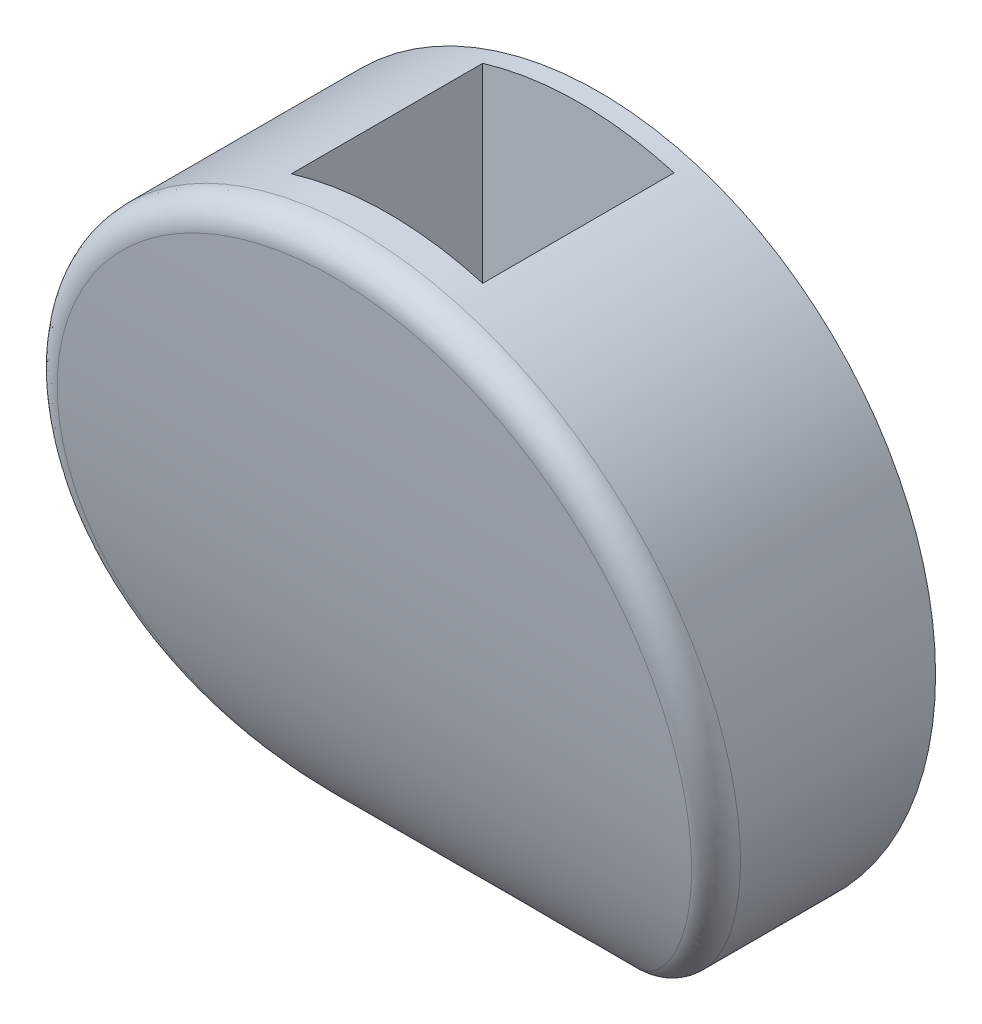
from build123d import *

# Parameters (mm, degrees)
ESQUISSE1_R                         = 67.000000112
BOSS_EXTRU_1_DEPTH                  = 53.34
ENL_V_MAT_EXTRU_1_DEPTH             = 110.092762836
ENL_V_MAT_EXTRU_1_DEPTH_BACK        = 110.092762836
CONG_1_R                            = 5
ENL_V_MAT_EXTRU_2_REACH             = 110.905
ESQUISSE5_W                         = 38.1
ESQUISSE5_H                         = 38.1
ENL_V_MAT_EXTRU_2_DIRECTION_2_DEPTH = 3.81


with BuildPart() as part:
    # Esquisse1 → Boss.-Extru.1 (new body)
    with BuildSketch(Plane.XY):
        with Locations((0.290695021, 0.290695021)):
            Circle(ESQUISSE1_R)
    extrude(amount=BOSS_EXTRU_1_DEPTH)

    # Esquisse4 → Enlèv. mat.-Extru.1 (cut, two sides: drawn at the far end of the back side and taken through both)
    with BuildSketch(Plane(origin=(0, 0, 0), x_dir=(0, 0, -1), z_dir=(1, 0, 0)).offset(-ENL_V_MAT_EXTRU_1_DEPTH_BACK)):
        with BuildLine():
            Line((-0.142164152, -67.127156989), (-53.34, -66.709305091))
            Line((-53.34, -66.709305091), (-53.34, 67.290695133))
            add(Edge.make_bspline(
                [(-53.34, 67.290695133), (-53.314901524, 64.965334409), (-44.651911328, -34.890273822), (-23.160447153, -66.373438876), (-0.142164152, -67.127156989)],
                knots=[0, 0, 0, 0, 0.3629696, 1, 1, 1, 1], degree=3))
        make_face()
    extrude(amount=ENL_V_MAT_EXTRU_1_DEPTH + ENL_V_MAT_EXTRU_1_DEPTH_BACK, mode=Mode.SUBTRACT)

    # Congé1
    cong_1_edges = [part.edges().sort_by_distance(p)[0] for p in [
        (-66.598538996, -3.560329145, 44.401259726),
    ]]
    fillet(cong_1_edges, radius=CONG_1_R)

    # Esquisse5 → Enlèv. mat.-Extru.2 (cut, up to next)
    with BuildSketch(Plane(origin=(0, 0, 0), x_dir=(1, 0, 0), z_dir=(0, 1, 0)), mode=Mode.PRIVATE) as enl_v_mat_extru_2_sk1:
        with Locations((0, -22.86)):
            Rectangle(ESQUISSE5_W, ESQUISSE5_H)
    enl_v_mat_extru_2_tool1 = extrude(enl_v_mat_extru_2_sk1.sketch, amount=ENL_V_MAT_EXTRU_2_REACH, mode=Mode.PRIVATE) & part.part
    add(enl_v_mat_extru_2_tool1.solids().sort_by_distance((0, 0, 22.86))[0], mode=Mode.SUBTRACT)

    # Esquisse5 → Enlèv. mat.-Extru.2 direction 2 (cut)
    with BuildSketch(Plane(origin=(0, 0, 0), x_dir=(1, 0, 0), z_dir=(0, 1, 0))):
        with Locations((0, -22.86)):
            Rectangle(ESQUISSE5_W, ESQUISSE5_H)
    extrude(amount=-ENL_V_MAT_EXTRU_2_DIRECTION_2_DEPTH, mode=Mode.SUBTRACT)


solid = part.part
